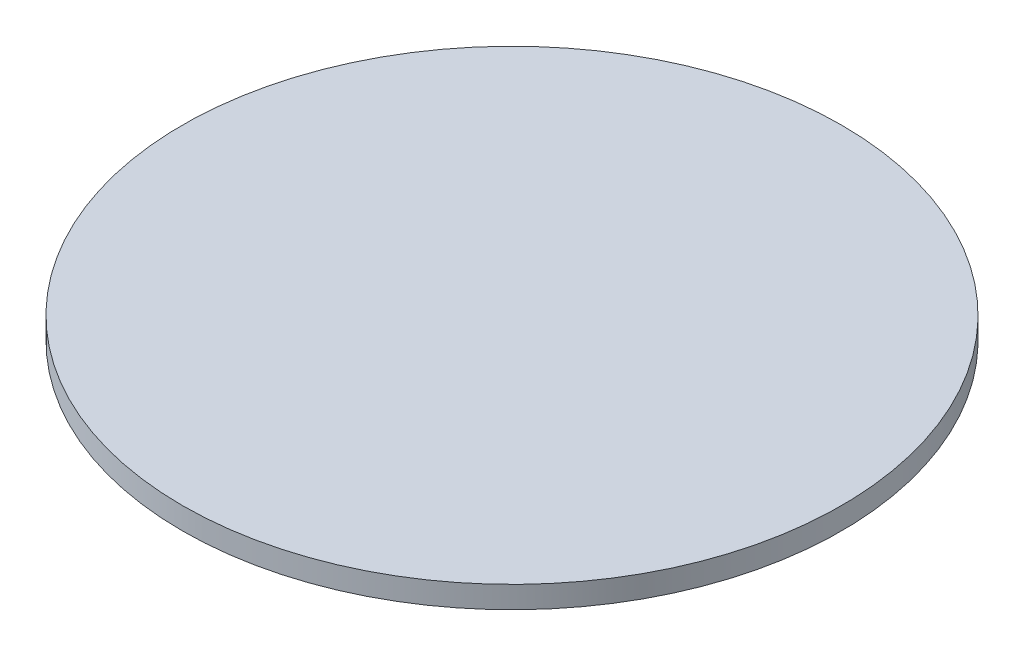
from build123d import *

# Parameters (mm, degrees)
SKETCH1_R           = 47.625
BOSS_EXTRUDE1_DEPTH = 3.175


with BuildPart() as part:
    # Sketch1 → Boss-Extrude1 (new body)
    with BuildSketch(Plane(origin=(0, 0, 0), x_dir=(1, 0, 0), z_dir=(0, 1, 0))):
        Circle(SKETCH1_R)
    extrude(amount=BOSS_EXTRUDE1_DEPTH)


solid = part.part
